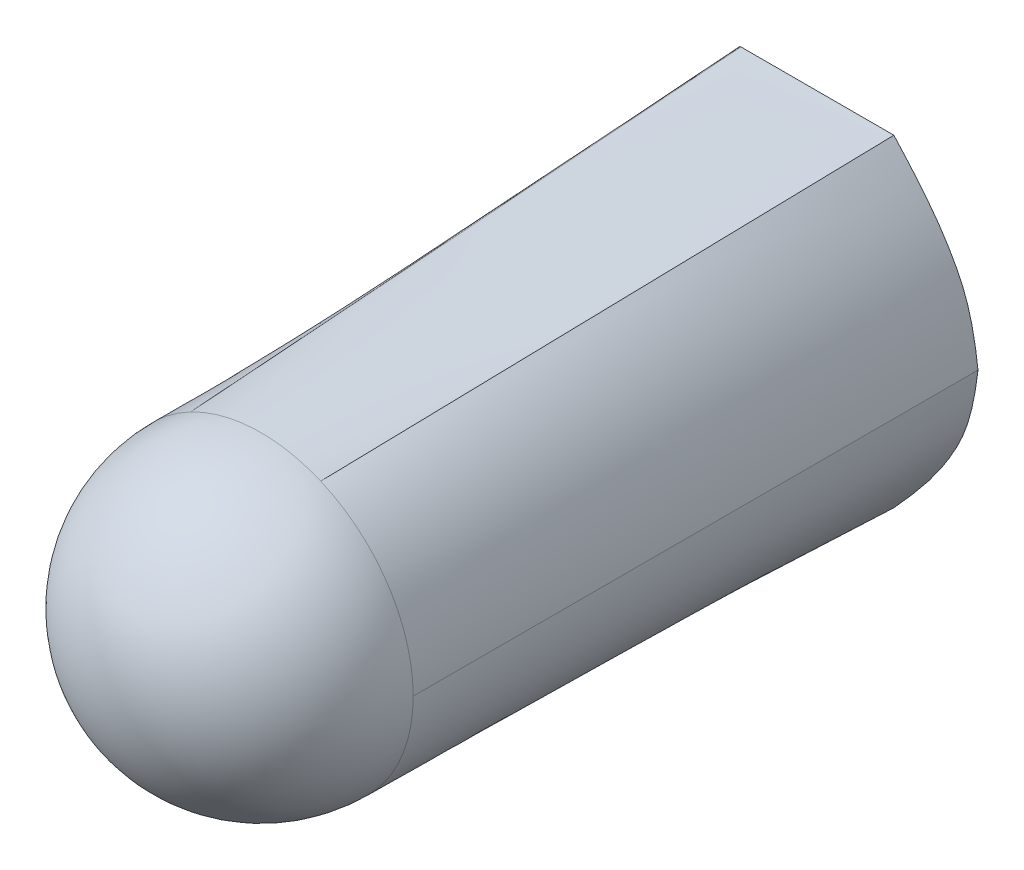
from build123d import *


with BuildPart() as part:
    # Loft1: read off the stored shape, not the designer's step
    # Loft1: loft between two sections, ruled curve by curve
    loft1_from = [
        Edge.make_bspline([(-1.962319172, 3.763617386, 15.755), (-0.835177405, 4.351299839, 15.755), (0.496291342, 4.402843001, 15.755), (1.665492002, 3.904055423, 15.755)], [0, 0, 0, 0, 1, 1, 1, 1], 3),
        Edge.make_bspline([(1.665492002, 3.904055423, 15.755), (2.056430126, 3.737279021, 15.755), (2.59141276, 3.405576222, 15.755), (3.179997489, 2.833345855, 15.755), (3.553604224, 2.3474722, 15.755), (3.853910061, 1.813176771, 15.755), (4.075445914, 1.238738673, 15.755), (4.212742694, 0.632437012, 15.755), (4.244468442, 0.212512932, 15.755), (4.244468442, 0, 15.755)], [0, 0, 0, 0, 0.25, 0.375, 0.5, 0.625, 0.75, 0.875, 1, 1, 1, 1], 3),
        Edge.make_bspline([(1.664167638, -3.904620139, 15.755), (1.374629167, -4.02802281, 15.755), (0.77141564, -4.208867018, 15.755), (-0.165486361, -4.275568066, 15.755), (-1.094397344, -4.136652906, 15.755), (-1.681768906, -3.909756812, 15.755), (-1.982110895, -3.753308202, 15.755), (-2.024416049, -3.730811305, 15.755), (-2.108280284, -3.684368394, 15.755), (-2.211666294, -3.623626111, 15.755), (-2.33327339, -3.546524565, 15.755), (-2.452279106, -3.46530324, 15.755), (-2.568538178, -3.380053162, 15.755), (-2.681905343, -3.290865359, 15.755), (-2.792235337, -3.197830857, 15.755), (-2.935098751, -3.068777292, 15.755), (-3.105358774, -2.898298723, 15.755), (-3.295453815, -2.68012129, 15.755), (-3.470425674, -2.449396136, 15.755), (-3.629368156, -2.207178692, 15.755), (-3.771375064, -1.954524388, 15.755), (-3.895880542, -1.692711132, 15.755), (-4.002318735, -1.423016833, 15.755), (-4.090123788, -1.1467194, 15.755), (-4.158729844, -0.86509674, 15.755), (-4.207978814, -0.579530352, 15.755), (-4.237712608, -0.291401732, 15.755), (-4.244419627, -0.098528829, 15.755), (-4.244516208, 0.094307051, 15.755), (-4.237998006, 0.287254116, 15.755), (-4.20853003, 0.575532172, 15.755), (-4.159525106, 0.861281284, 15.755), (-4.091136957, 1.143115051, 15.755), (-4.003519306, 1.41964707, 15.755), (-3.897237614, 1.689593575, 15.755), (-3.77285734, 1.9516708, 15.755), (-3.630943942, 2.204594979, 15.755), (-3.472062881, 2.447082347, 15.755), (-3.297123497, 2.67807316, 15.755), (-3.107035129, 2.896507676, 15.755), (-2.936761787, 3.067189738, 15.755), (-2.793877962, 3.196397497, 15.755), (-2.683528402, 3.289543211, 15.755), (-2.570138037, 3.378837662, 15.755), (-2.45385275, 3.464189692, 15.755), (-2.334818427, 3.545508141, 15.755), (-2.213180952, 3.622701851, 15.755), (-2.109768668, 3.683516696, 15.755), (-2.02588315, 3.730015043, 15.755), (-1.983567317, 3.752538777, 15.755), (-1.962319172, 3.763617386, 15.755)], [0, 0, 0, 0, 0.072759801, 0.145519603, 0.218279404, 0.291039205, 0.291039205, 0.296577103, 0.302115, 0.313190795, 0.32426659, 0.335342385, 0.34641818, 0.357493975, 0.36856977, 0.379645565, 0.401797155, 0.423948745, 0.446100335, 0.468251924, 0.490403514, 0.512555104, 0.534706694, 0.556858284, 0.579009874, 0.601161464, 0.623313054, 0.645464644, 0.645464644, 0.667623103, 0.689781563, 0.711940023, 0.734098483, 0.756256942, 0.778415402, 0.800573862, 0.822732322, 0.844890782, 0.867049241, 0.889207701, 0.911366161, 0.922445391, 0.933524621, 0.944603851, 0.95568308, 0.96676231, 0.97784154, 0.98892077, 0.994460385, 1, 1, 1, 1], 3),
        Edge.make_bspline([(4.244468442, 0, 15.755), (4.244468442, -0.212578268, 15.755), (4.212723402, -0.632628172, 15.755), (4.075345993, -1.239097722, 15.755), (3.853684003, -1.813676557, 15.755), (3.553212703, -2.348079267, 15.755), (3.179407362, -2.834020443, 15.755), (2.590521881, -3.406279419, 15.755), (2.055282519, -3.73792512, 15.755), (1.664167638, -3.904620139, 15.755)], [0, 0, 0, 0, 0.125, 0.25, 0.375, 0.5, 0.625, 0.75, 1, 1, 1, 1], 3),
    ]
    loft1_to = [
        Edge.make_bspline([(-2.365676415, 4.499999845, 0), (-0.944348849, 4.499999897, 0), (0.476978716, 4.499999948, 0), (1.898306282, 4.5, 0)], [0, 0, 0, 0, 1, 1, 1, 1], 3),
        Edge.make_bspline([(1.898306282, 4.5, 0), (2.189447131, 4.181338004, 0), (2.617056266, 3.696934319, 0), (3.140017311, 3.011527507, 0), (3.490030755, 2.464502666, 0), (3.797554208, 1.893903652, 0), (4.017685812, 1.280432396, 0), (4.158112399, 0.644189438, 0), (4.218722694, 0.215543151, 0), (4.244468442, 0, 0)], [0, 0, 0, 0, 0.25, 0.375, 0.5, 0.625, 0.75, 0.875, 1, 1, 1, 1], 3),
        Edge.make_bspline([(1.898306505, -4.5, 0), (1.545570373, -4.499999987, 0), (0.83627143, -4.499999962, 0), (-0.233603527, -4.499999923, 0), (-1.303516633, -4.499999885, 0), (-2.012890493, -4.49999986, 0), (-2.392525615, -4.49993902, 0), (-2.437385534, -4.462238299, 0), (-2.48786808, -4.368210504, 0), (-2.531331418, -4.240383501, 0), (-2.570763128, -4.084824911, 0), (-2.603106974, -3.92717914, 0), (-2.63132738, -3.76916585, 0), (-2.656640522, -3.610594073, 0), (-2.679706833, -3.451850801, 0), (-2.709054574, -3.240055097, 0), (-2.74438696, -2.975334222, 0), (-2.789573992, -2.658296259, 0), (-2.841951747, -2.342532517, 0), (-2.909614883, -2.029765238, 0), (-2.999610008, -1.722597725, 0), (-3.131990684, -1.430152564, 0), (-3.32361371, -1.171283708, 0), (-3.584813685, -0.979310336, 0), (-3.868916222, -0.839029018, 0), (-4.125058102, -0.631394523, 0), (-4.231325129, -0.319051212, 0), (-4.244468442, -0.10675079, 0), (-4.244468442, 0.106777791, 0), (-4.231362096, 0.31872801, 0), (-4.124858543, 0.63178191, 0), (-3.869044863, 0.839139186, 0), (-3.584533188, 0.97934347, 0), (-3.323603912, 1.171426953, 0), (-3.131815088, 1.43021893, 0), (-2.9998723, 1.722834389, 0), (-2.909513573, 2.029838476, 0), (-2.841970931, 2.342621345, 0), (-2.789546837, 2.658331647, 0), (-2.744399421, 2.975354523, 0), (-2.709049012, 3.240048087, 0), (-2.679710196, 3.451835607, 0), (-2.656646522, 3.610571504, 0), (-2.631341988, 3.76914179, 0), (-2.603109371, 3.927151619, 0), (-2.570764877, 4.084800779, 0), (-2.531343119, 4.240367559, 0), (-2.487873684, 4.368202662, 0), (-2.437394512, 4.46224354, 0), (-2.39252965, 4.499938578, 0), (-2.365676415, 4.499999845, 0)], [0, 0, 0, 0, 0.072759801, 0.145519603, 0.218279404, 0.291039205, 0.291039205, 0.296577103, 0.302115, 0.313190795, 0.32426659, 0.335342385, 0.34641818, 0.357493975, 0.36856977, 0.379645565, 0.401797155, 0.423948745, 0.446100335, 0.468251924, 0.490403514, 0.512555104, 0.534706694, 0.556858284, 0.579009874, 0.601161464, 0.623313054, 0.645464644, 0.645464644, 0.667623103, 0.689781563, 0.711940023, 0.734098483, 0.756256942, 0.778415402, 0.800573862, 0.822732322, 0.844890782, 0.867049241, 0.889207701, 0.911366161, 0.922445391, 0.933524621, 0.944603851, 0.95568308, 0.96676231, 0.97784154, 0.98892077, 0.994460385, 1, 1, 1, 1], 3),
        Edge.make_bspline([(4.244468442, 0, 0), (4.218918945, -0.213900205, 0), (4.158784737, -0.639072215, 0), (4.021356681, -1.264160976, 0), (3.809404837, -1.867549468, 0), (3.500913473, -2.44651898, 0), (3.151568065, -2.994950248, 0), (2.623467607, -3.690096431, 0), (2.192000706, -4.178543262, 0), (1.898306505, -4.5, 0)], [0, 0, 0, 0, 0.125, 0.25, 0.375, 0.5, 0.625, 0.75, 1, 1, 1, 1], 3),
    ]
    loft1 = Solid(Shell([*[Face.make_surface_from_curves(loft1_from[k], loft1_to[k]) for k in range(4)], Face(Wire(loft1_from)), Face(Wire(loft1_to))]))
    add(loft1)

    # Sketch4 → Revolve1 (revolve)
    with BuildSketch(Plane(origin=(0, 0, 0), x_dir=(1, 0, 0), z_dir=(0, 1, 0))):
        with BuildLine():
            Line((0, -15.755), (0, -20))
            ThreePointArc((0, -20), (-3.001668286, -18.756668286), (-4.245, -15.755))
            Line((-4.245, -15.755), (0, -15.755))
        make_face()
    revolve(axis=Axis((0, 0, 15.755), (0, 0, 1)))


solid = part.part
